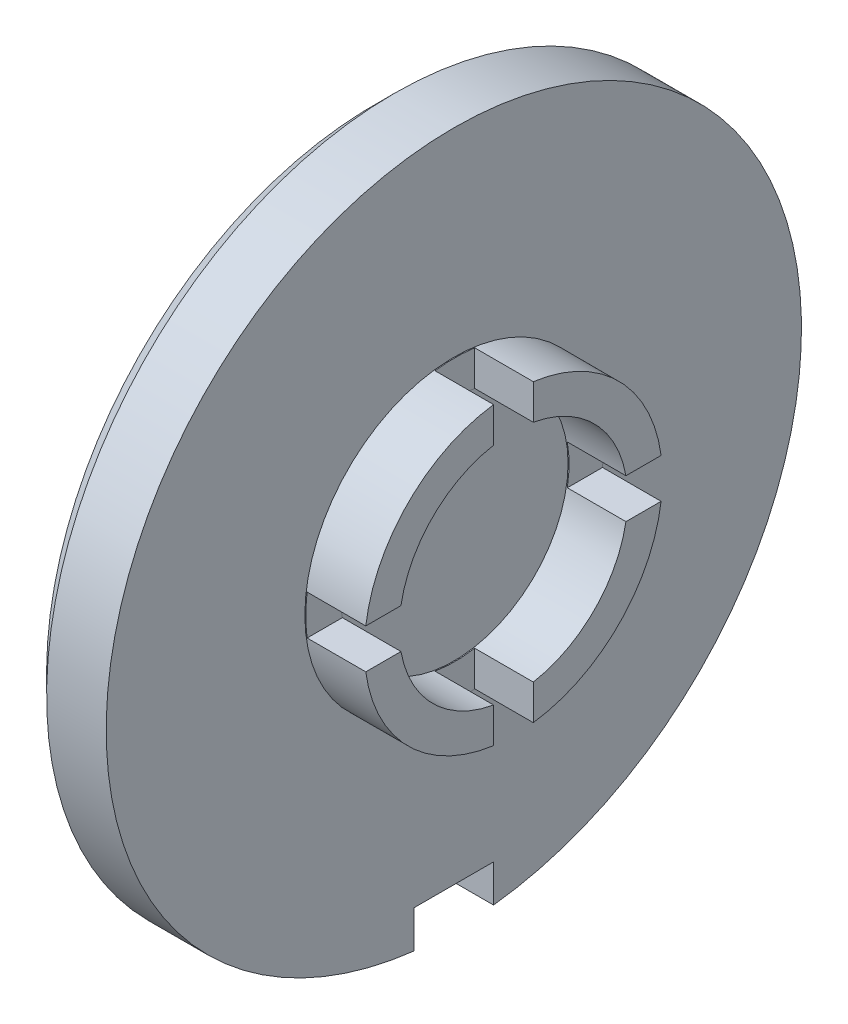
from build123d import *

# Parameters (mm, degrees)
BOSS_EXTRUDE1_START = -55.2
SKETCH2_W           = 1.28
SKETCH2_H           = 0.8
BOSS_EXTRUDE1_DEPTH = 6.4
BOSS_EXTRUDE2_START = -52.4
SKETCH3_W           = 1.28
SKETCH3_H           = 6.4
BOSS_EXTRUDE2_DEPTH = 0.8
BOSS_EXTRUDE3_START = -52.8
SKETCH4_W           = 1.8
SKETCH4_H           = 0.9
BOSS_EXTRUDE3_DEPTH = 1.6


with BuildPart() as part:
    # Sketch1 → Revolve1 (revolve)
    with BuildSketch(Plane.XY.offset(-52)):
        Polygon((-82.8, -62.7), (-84, -62.7), (-84, -65), (-85.6, -65), (-85.6, -58.4), (-85.2, -58), (-84, -58), (-84, -62), (-82.8, -62), align=None)
    revolve(axis=Axis((-90.6, -65, -52), (1, 0, 0)))


with BuildPart() as body_2:
    # Sketch2 → Boss-Extrude1 (new body)
    with BuildSketch(Plane.XY.offset(BOSS_EXTRUDE1_START)):
        with Locations((-83.34, -65)):
            Rectangle(SKETCH2_W, SKETCH2_H)
    extrude(amount=BOSS_EXTRUDE1_DEPTH)


with BuildPart() as part_1:
    add(part.part)

    # Combine1: cut body 2
    add(body_2.part, mode=Mode.SUBTRACT)


with BuildPart() as body_2_2:
    # Sketch3 → Boss-Extrude2 (new body)
    with BuildSketch(Plane.XY.offset(BOSS_EXTRUDE2_START)):
        with Locations((-83.34, -65)):
            Rectangle(SKETCH3_W, SKETCH3_H)
    extrude(amount=BOSS_EXTRUDE2_DEPTH)


with BuildPart() as part_2:
    add(part_1.part)

    # Combine2: cut body 2 2
    add(body_2_2.part, mode=Mode.SUBTRACT)


with BuildPart() as body_2_3:
    # Sketch4 → Boss-Extrude3 (new body)
    with BuildSketch(Plane.XY.offset(BOSS_EXTRUDE3_START)):
        with Locations((-84.8, -71.65)):
            Rectangle(SKETCH4_W, SKETCH4_H)
    extrude(amount=BOSS_EXTRUDE3_DEPTH)


with BuildPart() as part_3:
    add(part_2.part)

    # Combine3: cut body 2 3
    add(body_2_3.part, mode=Mode.SUBTRACT)


solid = part_3.part
